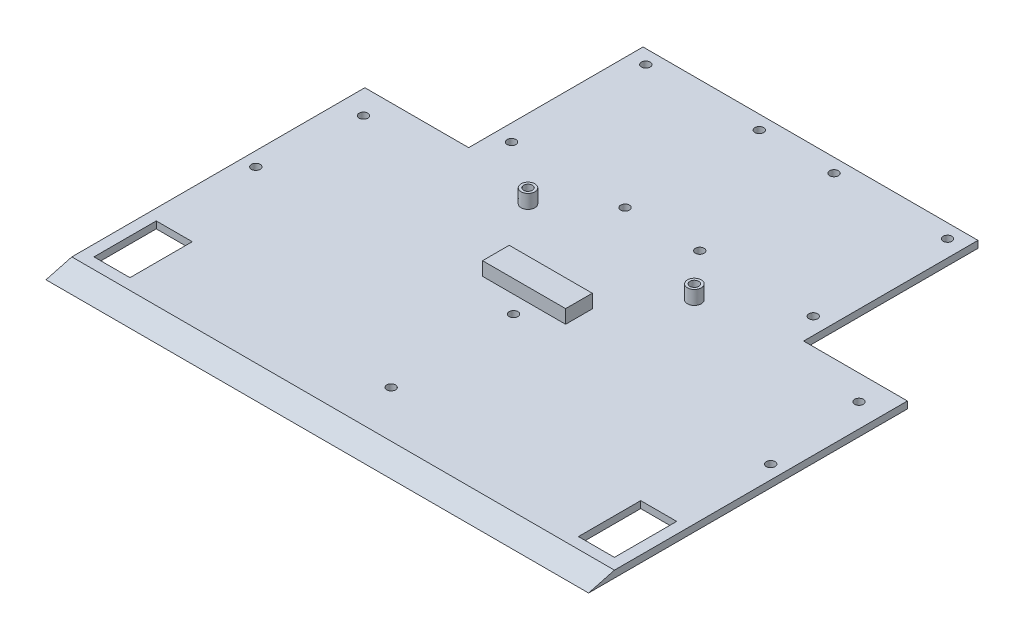
from build123d import *

# Parameters (mm, degrees)
SALIENTE_EXTRUIR1_DEPTH = 196
CORTAR_EXTRUIR1_REACH   = 266.89
CROQUIS2_W              = 37.5
CROQUIS2_H              = 62.989872981
CORTAR_EXTRUIR2_REACH   = 266.89
CROQUIS4_W              = 13
CROQUIS4_H              = 22.5
CUT_EXTRUDE1_REACH      = 266.89
SKETCH1_R               = 1.585
CUT_EXTRUDE2_REACH      = 266.89
SKETCH2_R               = 1.585
CUT_EXTRUDE3_REACH      = 266.89
SKETCH3_R               = 1.585
SKETCH4_R               = 2.5
SKETCH4_R_2             = 1.6
BOSS_EXTRUDE1_DEPTH     = 5
SKETCH5_W               = 30
SKETCH5_H               = 9.637731071
BOSS_EXTRUDE2_DEPTH     = 4.9
CUT_EXTRUDE4_START      = -4.9
SKETCH6_R               = 1.6
CUT_EXTRUDE4_DEPTH      = 4.9
SKETCH7_R               = 1.585
CUT_EXTRUDE5_DEPTH      = 10


with BuildPart() as part:
    # Croquis1 → Saliente-Extruir1 (new body)
    with BuildSketch(Plane(origin=(0, 0, 0), x_dir=(0, 0, -1), z_dir=(1, 0, 0))):
        Polygon((0, 0), (178.17, 0), (178.17, 2.5), (9.330127019, 2.5), align=None)
    extrude(amount=SALIENTE_EXTRUIR1_DEPTH)

    # Croquis2 → Cortar-Extruir1 (cut, up to next)
    with BuildSketch(Plane(origin=(0, 0, 0), x_dir=(-1, 0, 0), z_dir=(0, -1, 0)), mode=Mode.PRIVATE) as cortar_extruir1_sk1:
        with Locations((-18.75, 146.67506351)):
            Rectangle(CROQUIS2_W, CROQUIS2_H)
    cortar_extruir1_tool1 = extrude(cortar_extruir1_sk1.sketch, amount=-CORTAR_EXTRUIR1_REACH, mode=Mode.PRIVATE) & part.part
    # Croquis2 → Cortar-Extruir1 (cut, up to next)
    with BuildSketch(Plane(origin=(0, 0, 0), x_dir=(-1, 0, 0), z_dir=(0, -1, 0)), mode=Mode.PRIVATE) as cortar_extruir1_sk2:
        with Locations((-177.25, 146.67506351)):
            Rectangle(CROQUIS2_W, CROQUIS2_H)
    cortar_extruir1_tool2 = extrude(cortar_extruir1_sk2.sketch, amount=-CORTAR_EXTRUIR1_REACH, mode=Mode.PRIVATE) & part.part
    add(cortar_extruir1_tool1.solids().sort_by_distance((18.75, 0, -146.675064))[0], mode=Mode.SUBTRACT)
    add(cortar_extruir1_tool2.solids().sort_by_distance((177.25, 0, -146.675064))[0], mode=Mode.SUBTRACT)

    # Croquis4 → Cortar-Extruir2 (cut, up to next)
    with BuildSketch(Plane(origin=(0, 2.5, 0), x_dir=(1, 0, 0), z_dir=(0, 1, 0)), mode=Mode.PRIVATE) as cortar_extruir2_sk1:
        with Locations((10.5, 24.580127019)):
            Rectangle(CROQUIS4_W, CROQUIS4_H)
    cortar_extruir2_tool1 = extrude(cortar_extruir2_sk1.sketch, amount=-CORTAR_EXTRUIR2_REACH, mode=Mode.PRIVATE) & part.part
    cortar_extruir2 = cortar_extruir2_tool1.solids().sort_by_distance((10.5, 2.5, -24.580127))[0]
    add(cortar_extruir2, mode=Mode.SUBTRACT)

    # Simetría1: Cortar-Extruir2 across plane
    add(cortar_extruir2.mirror(Plane(origin=(98, 0, 0), x_dir=(0, 0, 1), z_dir=(1, 0, 0))), mode=Mode.SUBTRACT)

    # Sketch1 → Cut-Extrude1 (cut, up to next)
    with BuildSketch(Plane(origin=(0, 2.5, 0), x_dir=(1, 0, 0), z_dir=(0, 1, 0)), mode=Mode.PRIVATE) as cut_extrude1_sk1:
        with Locations((187.5, 106.180127019)):
            Circle(SKETCH1_R)
    cut_extrude1_tool1 = extrude(cut_extrude1_sk1.sketch, amount=-CUT_EXTRUDE1_REACH, mode=Mode.PRIVATE) & part.part
    # Sketch1 → Cut-Extrude1 (cut, up to next)
    with BuildSketch(Plane(origin=(0, 2.5, 0), x_dir=(1, 0, 0), z_dir=(0, 1, 0)), mode=Mode.PRIVATE) as cut_extrude1_sk2:
        with Locations((8.5, 106.180127019)):
            Circle(SKETCH1_R)
    cut_extrude1_tool2 = extrude(cut_extrude1_sk2.sketch, amount=-CUT_EXTRUDE1_REACH, mode=Mode.PRIVATE) & part.part
    add(cut_extrude1_tool1.solids().sort_by_distance((187.5, 2.5, -106.180127))[0], mode=Mode.SUBTRACT)
    add(cut_extrude1_tool2.solids().sort_by_distance((8.5, 2.5, -106.180127))[0], mode=Mode.SUBTRACT)

    # Sketch2 → Cut-Extrude2 (cut, up to next)
    with BuildSketch(Plane(origin=(0, 2.5, 0), x_dir=(1, 0, 0), z_dir=(0, 1, 0)), mode=Mode.PRIVATE) as cut_extrude2_sk1:
        with Locations((98.5, 26.180127019)):
            Circle(SKETCH2_R)
    cut_extrude2_tool1 = extrude(cut_extrude2_sk1.sketch, amount=-CUT_EXTRUDE2_REACH, mode=Mode.PRIVATE) & part.part
    add(cut_extrude2_tool1.solids().sort_by_distance((98.5, 2.5, -26.180127))[0], mode=Mode.SUBTRACT)

    # Sketch3 → Cut-Extrude3 (cut, up to next)
    with BuildSketch(Plane(origin=(0, 2.5, 0), x_dir=(1, 0, 0), z_dir=(0, 1, 0)), mode=Mode.PRIVATE) as cut_extrude3_sk1:
        with Locations((111.5, 124.67)):
            Circle(SKETCH3_R)
    cut_extrude3_tool1 = extrude(cut_extrude3_sk1.sketch, amount=-CUT_EXTRUDE3_REACH, mode=Mode.PRIVATE) & part.part
    # Sketch3 → Cut-Extrude3 (cut, up to next)
    with BuildSketch(Plane(origin=(0, 2.5, 0), x_dir=(1, 0, 0), z_dir=(0, 1, 0)), mode=Mode.PRIVATE) as cut_extrude3_sk2:
        with Locations((152.5, 124.67)):
            Circle(SKETCH3_R)
    cut_extrude3_tool2 = extrude(cut_extrude3_sk2.sketch, amount=-CUT_EXTRUDE3_REACH, mode=Mode.PRIVATE) & part.part
    # Sketch3 → Cut-Extrude3 (cut, up to next)
    with BuildSketch(Plane(origin=(0, 2.5, 0), x_dir=(1, 0, 0), z_dir=(0, 1, 0)), mode=Mode.PRIVATE) as cut_extrude3_sk3:
        with Locations((152.5, 173.17)):
            Circle(SKETCH3_R)
    cut_extrude3_tool3 = extrude(cut_extrude3_sk3.sketch, amount=-CUT_EXTRUDE3_REACH, mode=Mode.PRIVATE) & part.part
    # Sketch3 → Cut-Extrude3 (cut, up to next)
    with BuildSketch(Plane(origin=(0, 2.5, 0), x_dir=(1, 0, 0), z_dir=(0, 1, 0)), mode=Mode.PRIVATE) as cut_extrude3_sk4:
        with Locations((111.5, 173.17)):
            Circle(SKETCH3_R)
    cut_extrude3_tool4 = extrude(cut_extrude3_sk4.sketch, amount=-CUT_EXTRUDE3_REACH, mode=Mode.PRIVATE) & part.part
    # Sketch3 → Cut-Extrude3 (cut, up to next)
    with BuildSketch(Plane(origin=(0, 2.5, 0), x_dir=(1, 0, 0), z_dir=(0, 1, 0)), mode=Mode.PRIVATE) as cut_extrude3_sk5:
        with Locations((84.5, 173.17)):
            Circle(SKETCH3_R)
    cut_extrude3_tool5 = extrude(cut_extrude3_sk5.sketch, amount=-CUT_EXTRUDE3_REACH, mode=Mode.PRIVATE) & part.part
    # Sketch3 → Cut-Extrude3 (cut, up to next)
    with BuildSketch(Plane(origin=(0, 2.5, 0), x_dir=(1, 0, 0), z_dir=(0, 1, 0)), mode=Mode.PRIVATE) as cut_extrude3_sk6:
        with Locations((43.5, 173.17)):
            Circle(SKETCH3_R)
    cut_extrude3_tool6 = extrude(cut_extrude3_sk6.sketch, amount=-CUT_EXTRUDE3_REACH, mode=Mode.PRIVATE) & part.part
    # Sketch3 → Cut-Extrude3 (cut, up to next)
    with BuildSketch(Plane(origin=(0, 2.5, 0), x_dir=(1, 0, 0), z_dir=(0, 1, 0)), mode=Mode.PRIVATE) as cut_extrude3_sk7:
        with Locations((43.5, 124.67)):
            Circle(SKETCH3_R)
    cut_extrude3_tool7 = extrude(cut_extrude3_sk7.sketch, amount=-CUT_EXTRUDE3_REACH, mode=Mode.PRIVATE) & part.part
    # Sketch3 → Cut-Extrude3 (cut, up to next)
    with BuildSketch(Plane(origin=(0, 2.5, 0), x_dir=(1, 0, 0), z_dir=(0, 1, 0)), mode=Mode.PRIVATE) as cut_extrude3_sk8:
        with Locations((84.5, 124.67)):
            Circle(SKETCH3_R)
    cut_extrude3_tool8 = extrude(cut_extrude3_sk8.sketch, amount=-CUT_EXTRUDE3_REACH, mode=Mode.PRIVATE) & part.part
    add(cut_extrude3_tool1.solids().sort_by_distance((111.5, 2.5, -124.67))[0], mode=Mode.SUBTRACT)
    add(cut_extrude3_tool2.solids().sort_by_distance((152.5, 2.5, -124.67))[0], mode=Mode.SUBTRACT)
    add(cut_extrude3_tool3.solids().sort_by_distance((152.5, 2.5, -173.17))[0], mode=Mode.SUBTRACT)
    add(cut_extrude3_tool4.solids().sort_by_distance((111.5, 2.5, -173.17))[0], mode=Mode.SUBTRACT)
    add(cut_extrude3_tool5.solids().sort_by_distance((84.5, 2.5, -173.17))[0], mode=Mode.SUBTRACT)
    add(cut_extrude3_tool6.solids().sort_by_distance((43.5, 2.5, -173.17))[0], mode=Mode.SUBTRACT)
    add(cut_extrude3_tool7.solids().sort_by_distance((43.5, 2.5, -124.67))[0], mode=Mode.SUBTRACT)
    add(cut_extrude3_tool8.solids().sort_by_distance((84.5, 2.5, -124.67))[0], mode=Mode.SUBTRACT)

    # Sketch4 → Boss-Extrude1 (add)
    # profile 1 of 2: a face of its own
    with BuildSketch(Plane(origin=(0, 2.5, 0), x_dir=(1, 0, 0), z_dir=(0, 1, 0))):
        with Locations((65.776416732, 108.336862559)):
            Circle(SKETCH4_R)
        with Locations((65.776416732, 108.336862559)):
            Circle(SKETCH4_R_2, mode=Mode.SUBTRACT)
    # profile 2 of 2: a face of its own
    with BuildSketch(Plane(origin=(0, 2.5, 0), x_dir=(1, 0, 0), z_dir=(0, 1, 0))):
        with Locations((125.876416732, 108.336862559)):
            Circle(SKETCH4_R)
        with Locations((125.876416732, 108.336862559)):
            Circle(SKETCH4_R_2, mode=Mode.SUBTRACT)
    extrude(amount=BOSS_EXTRUDE1_DEPTH)

    # Sketch5 → Boss-Extrude2 (add)
    with BuildSketch(Plane(origin=(0, 2.5, 0), x_dir=(1, 0, 0), z_dir=(0, 1, 0))):
        with Locations((95.271957283, 82.2427394)):
            Rectangle(SKETCH5_W, SKETCH5_H)
    extrude(amount=BOSS_EXTRUDE2_DEPTH)

    # Sketch6 → Cut-Extrude4 (cut)
    with BuildSketch(Plane(origin=(0, 2.5, 0), x_dir=(1, 0, 0), z_dir=(0, 1, 0)).offset(CUT_EXTRUDE4_START)):
        with Locations((125.876416732, 108.336862559)):
            Circle(SKETCH6_R)
        with Locations((65.776416732, 108.336862559)):
            Circle(SKETCH6_R)
    extrude(amount=CUT_EXTRUDE4_DEPTH, mode=Mode.SUBTRACT)

    # Sketch7 → Cut-Extrude5 (cut)
    with BuildSketch(Plane(origin=(0, 2.5, 0), x_dir=(1, 0, 0), z_dir=(0, 1, 0))):
        with Locations((5.067111952, 70.727811806)):
            Circle(SKETCH7_R)
        with Locations((97.681935477, 71.208529763)):
            Circle(SKETCH7_R)
        with Locations((191.067111952, 70.727811806)):
            Circle(SKETCH7_R)
    extrude(amount=-CUT_EXTRUDE5_DEPTH, mode=Mode.SUBTRACT)


solid = part.part
